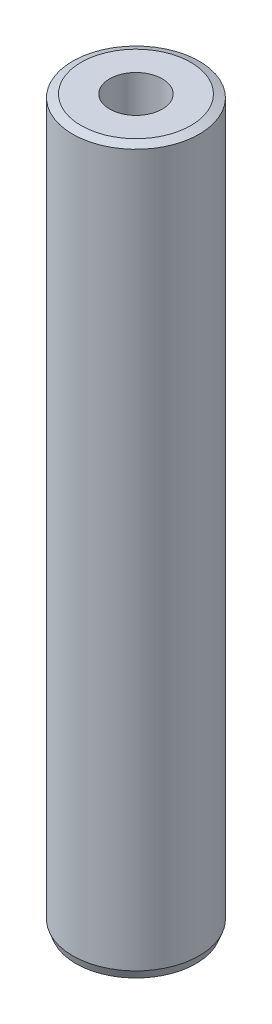
from build123d import *
from OCP.BRepFilletAPI import BRepFilletAPI_MakeChamfer

# Parameters (mm, degrees)
SKETCH1_R           = 52.5
BOSS_EXTRUDE1_DEPTH = 600
SKETCH2_R           = 21.833347485
CUT_EXTRUDE1_DEPTH  = 605.576297914
CHAMFER1_SIZE       = 2.672026491
CHAMFER1_SIZE2      = 7.000879001


with BuildPart() as part:
    # Sketch1 → Boss-Extrude1 (new body)
    with BuildSketch(Plane(origin=(0, 0, 0), x_dir=(1, 0, 0), z_dir=(0, 1, 0))):
        Circle(SKETCH1_R)
    extrude(amount=BOSS_EXTRUDE1_DEPTH)

    # Sketch2 → Cut-Extrude1 (cut, through all)
    with BuildSketch(Plane(origin=(0, 0, 0), x_dir=(1, 0, 0), z_dir=(0, 1, 0))):
        Circle(SKETCH2_R)
    extrude(amount=CUT_EXTRUDE1_DEPTH, mode=Mode.SUBTRACT)

    # Chamfer1: one chamfer whose edges measure the first distance from different faces: ONE call of the kernel's chamfer builder (chamfer() names one face for all edges)
    chamfer1_edges_1 = [part.edges().sort_by_distance(p)[0] for p in [
        (-52.5, 600, 0),
    ]]
    chamfer1_side_1 = [part.faces().sort_by_distance(p)[0] for p in [
        (-52.5, 300, 0),
    ]]
    chamfer1_edges_2 = [part.edges().sort_by_distance(p)[0] for p in [
        (-52.5, 0, 0),
    ]]
    chamfer1_side_2 = [part.faces().sort_by_distance(p)[0] for p in [
        (-51.01507576, 0, 0),
    ]]
    chamfer1 = BRepFilletAPI_MakeChamfer(part.part.solid().wrapped)
    for e in chamfer1_edges_1:
        chamfer1.Add(CHAMFER1_SIZE, CHAMFER1_SIZE2, e.wrapped, chamfer1_side_1[0].wrapped)  # the first distance lies on this face
    for e in chamfer1_edges_2:
        chamfer1.Add(CHAMFER1_SIZE, CHAMFER1_SIZE2, e.wrapped, chamfer1_side_2[0].wrapped)  # the first distance lies on this face
    add(Compound.cast(chamfer1.Shape()), mode=Mode.REPLACE)


solid = part.part
